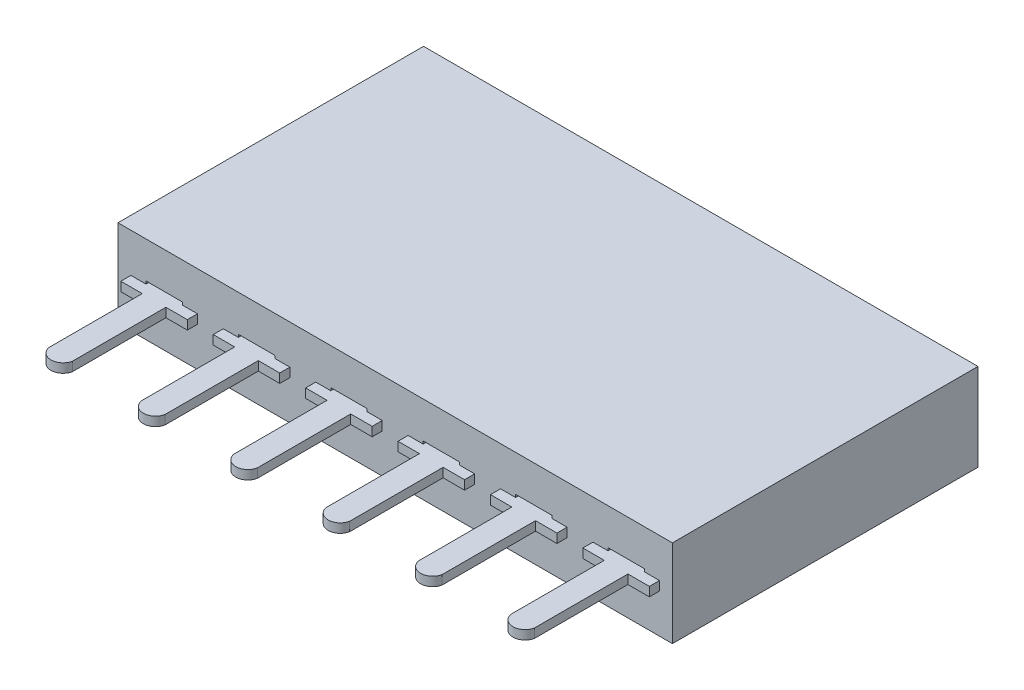
from build123d import *

# Parameters (mm, degrees)
SKETCH1_W               = 2.54
SKETCH1_H               = 2.4
SKETCH1_W_2             = 1.4
SKETCH1_H_2             = 1.45
BOSS_EXTRUDE1_DEPTH     = 4.2
BOSS_EXTRUDE3_START     = -1.2
BOSS_EXTRUDE3_DEPTH     = 0.125
LPATTERN1_START         = -0.125
LPATTERN1_DEPTH         = 0.25
LPATTERN1_2_DEPTH       = 0.25
LPATTERN1_3_DEPTH       = 0.25
LPATTERN1_4_DEPTH       = 0.25
LPATTERN1_START_2       = -4.2
LPATTERN1_5_OUTLINE_W   = 12.7
LPATTERN1_5_OUTLINE_H   = 2.4
LPATTERN1_5_OUTLINE_W_2 = 1.4
LPATTERN1_5_OUTLINE_H_2 = 1.45
LPATTERN1_5_DEPTH       = 8.4
LPATTERN1_6_DEPTH       = 0.25
BOSS_EXTRUDE4_START     = -8.4
SKETCH5_W               = 1.4
SKETCH5_H               = 1.45
SKETCH5_W_2             = 1
SKETCH5_H_2             = 0.4
BOSS_EXTRUDE4_DEPTH     = 8.4
LPATTERN2_COUNT         = 6
LPATTERN2_PITCH         = 2.54


# Read off the part's stored shape, not the designer's step: LPattern1
with BuildPart() as part:
    # Sketch1 → Boss-Extrude1 (new, symmetric)
    with BuildSketch(Plane.XY):
        Rectangle(SKETCH1_W, SKETCH1_H)
        Rectangle(SKETCH1_W_2, SKETCH1_H_2, mode=Mode.SUBTRACT)
    extrude(amount=BOSS_EXTRUDE1_DEPTH, both=True)

    # LPattern1 5 outline → LPattern1 5 (add)
    with BuildSketch(Plane.XY.offset(LPATTERN1_START_2)):
        with Locations((7.62, 0)):
            Rectangle(LPATTERN1_5_OUTLINE_W, LPATTERN1_5_OUTLINE_H)
        with Locations((2.54, 0)):
            Rectangle(LPATTERN1_5_OUTLINE_W_2, LPATTERN1_5_OUTLINE_H_2, mode=Mode.SUBTRACT)
        with Locations((5.08, 0)):
            Rectangle(LPATTERN1_5_OUTLINE_W_2, LPATTERN1_5_OUTLINE_H_2, mode=Mode.SUBTRACT)
        with Locations((7.62, 0)):
            Rectangle(LPATTERN1_5_OUTLINE_W_2, LPATTERN1_5_OUTLINE_H_2, mode=Mode.SUBTRACT)
        with Locations((10.16, 0)):
            Rectangle(LPATTERN1_5_OUTLINE_W_2, LPATTERN1_5_OUTLINE_H_2, mode=Mode.SUBTRACT)
        with Locations((12.7, 0)):
            Rectangle(LPATTERN1_5_OUTLINE_W_2, LPATTERN1_5_OUTLINE_H_2, mode=Mode.SUBTRACT)
    extrude(amount=LPATTERN1_5_DEPTH)



with BuildPart() as body_2:
    # Sketch3 → Boss-Extrude3 (new, symmetric)
    with BuildSketch(Plane(origin=(0, 1.2, 0), x_dir=(1, 0, 0), z_dir=(0, 1, 0)).offset(BOSS_EXTRUDE3_START)):
        with BuildLine():
            Line((-0.914219602, -3.853355377), (-0.914219602, -4.477752268))
            Line((-0.914219602, -4.477752268), (-0.325, -4.477752268))
            Line((-0.325, -4.477752268), (-0.325, -7.045003795))
            ThreePointArc((-0.325, -7.045003795), (0, -7.311534777), (0.325, -7.045003795))
            Line((0.325, -7.045003795), (0.325, -4.477752268))
            Line((0.325, -4.477752268), (0.914219602, -4.477752268))
            Line((0.914219602, -4.477752268), (0.914219602, -3.853355377))
            Line((0.914219602, -3.853355377), (-0.914219602, -3.853355377))
        make_face()
    extrude(amount=BOSS_EXTRUDE3_DEPTH, both=True)


with BuildPart() as body_3:
    # LPattern1 outline → LPattern1 (new body)
    with BuildSketch(Plane(origin=(0, 0, 0), x_dir=(1, 0, 0), z_dir=(0, 1, 0)).offset(LPATTERN1_START)):
        with BuildLine():
            Line((11.074219602, -4.477752268), (11.074219602, -3.853355377))
            Line((11.074219602, -3.853355377), (9.245780398, -3.853355377))
            Line((9.245780398, -3.853355377), (9.245780398, -4.477752268))
            Line((9.245780398, -4.477752268), (9.835, -4.477752268))
            Line((9.835, -4.477752268), (9.835, -7.045003795))
            ThreePointArc((9.835, -7.045003795), (10.16, -7.311534777), (10.485, -7.045003795))
            Line((10.485, -7.045003795), (10.485, -4.477752268))
            Line((10.485, -4.477752268), (11.074219602, -4.477752268))
        make_face()
    extrude(amount=LPATTERN1_DEPTH)


with BuildPart() as body_4:
    # LPattern1 2 outline → LPattern1 2 (new body)
    with BuildSketch(Plane(origin=(0, 0, 0), x_dir=(1, 0, 0), z_dir=(0, 1, 0)).offset(LPATTERN1_START)):
        with BuildLine():
            Line((8.534219602, -4.477752268), (8.534219602, -3.853355377))
            Line((8.534219602, -3.853355377), (6.705780398, -3.853355377))
            Line((6.705780398, -3.853355377), (6.705780398, -4.477752268))
            Line((6.705780398, -4.477752268), (7.295, -4.477752268))
            Line((7.295, -4.477752268), (7.295, -7.045003795))
            ThreePointArc((7.295, -7.045003795), (7.62, -7.311534777), (7.945, -7.045003795))
            Line((7.945, -7.045003795), (7.945, -4.477752268))
            Line((7.945, -4.477752268), (8.534219602, -4.477752268))
        make_face()
    extrude(amount=LPATTERN1_2_DEPTH)


with BuildPart() as body_5:
    # LPattern1 3 outline → LPattern1 3 (new body)
    with BuildSketch(Plane(origin=(0, 0, 0), x_dir=(1, 0, 0), z_dir=(0, 1, 0)).offset(LPATTERN1_START)):
        with BuildLine():
            Line((5.994219602, -4.477752268), (5.994219602, -3.853355377))
            Line((5.994219602, -3.853355377), (4.165780398, -3.853355377))
            Line((4.165780398, -3.853355377), (4.165780398, -4.477752268))
            Line((4.165780398, -4.477752268), (4.755, -4.477752268))
            Line((4.755, -4.477752268), (4.755, -7.045003795))
            ThreePointArc((4.755, -7.045003795), (5.08, -7.311534777), (5.405, -7.045003795))
            Line((5.405, -7.045003795), (5.405, -4.477752268))
            Line((5.405, -4.477752268), (5.994219602, -4.477752268))
        make_face()
    extrude(amount=LPATTERN1_3_DEPTH)


with BuildPart() as body_6:
    # LPattern1 4 outline → LPattern1 4 (new body)
    with BuildSketch(Plane(origin=(0, 0, 0), x_dir=(1, 0, 0), z_dir=(0, 1, 0)).offset(LPATTERN1_START)):
        with BuildLine():
            Line((3.454219602, -4.477752268), (3.454219602, -3.853355377))
            Line((3.454219602, -3.853355377), (1.625780398, -3.853355377))
            Line((1.625780398, -3.853355377), (1.625780398, -4.477752268))
            Line((1.625780398, -4.477752268), (2.215, -4.477752268))
            Line((2.215, -4.477752268), (2.215, -7.045003795))
            ThreePointArc((2.215, -7.045003795), (2.54, -7.311534777), (2.865, -7.045003795))
            Line((2.865, -7.045003795), (2.865, -4.477752268))
            Line((2.865, -4.477752268), (3.454219602, -4.477752268))
        make_face()
    extrude(amount=LPATTERN1_4_DEPTH)


with BuildPart() as body_7:
    # LPattern1 6 outline → LPattern1 6 (new body)
    with BuildSketch(Plane(origin=(0, 0, 0), x_dir=(1, 0, 0), z_dir=(0, 1, 0)).offset(LPATTERN1_START)):
        with BuildLine():
            Line((13.614219602, -4.477752268), (13.614219602, -3.853355377))
            Line((13.614219602, -3.853355377), (11.785780398, -3.853355377))
            Line((11.785780398, -3.853355377), (11.785780398, -4.477752268))
            Line((11.785780398, -4.477752268), (12.375, -4.477752268))
            Line((12.375, -4.477752268), (12.375, -7.045003795))
            ThreePointArc((12.375, -7.045003795), (12.7, -7.311534777), (13.025, -7.045003795))
            Line((13.025, -7.045003795), (13.025, -4.477752268))
            Line((13.025, -4.477752268), (13.614219602, -4.477752268))
        make_face()
    extrude(amount=LPATTERN1_6_DEPTH)


with BuildPart() as part_1:
    add(part.part)

    add(body_7.part)  # Boss-Extrude4 merges body 7
    # Sketch5 → Boss-Extrude4 (add)
    with BuildSketch(Plane(origin=(0, 0, -4.2), x_dir=(-1, 0, 0), z_dir=(0, 0, -1)).offset(BOSS_EXTRUDE4_START)):
        with Locations((-12.7, 0)):
            Rectangle(SKETCH5_W, SKETCH5_H)
        with Locations((-12.7, 0)):
            Rectangle(SKETCH5_W_2, SKETCH5_H_2, mode=Mode.SUBTRACT)
    boss_extrude4 = extrude(amount=BOSS_EXTRUDE4_DEPTH)


    add(body_2.part)  # LPattern2 merges body 2

    add(body_3.part)  # LPattern2 merges body 3

    add(body_4.part)  # LPattern2 merges body 4

    add(body_5.part)  # LPattern2 merges body 5

    add(body_6.part)  # LPattern2 merges body 6
    # LPattern2: Boss-Extrude4 ×6
    with Locations(*[(-i * LPATTERN2_PITCH, 0, 0) for i in range(1, LPATTERN2_COUNT)]):
        add(boss_extrude4)


solid = part_1.part
